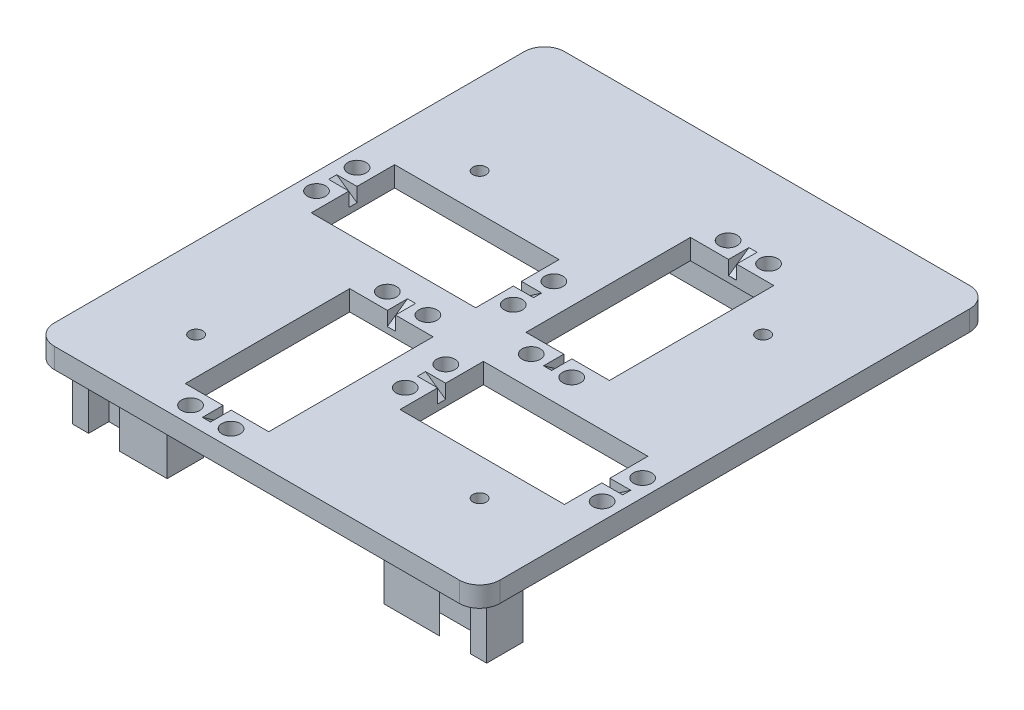
from build123d import *

# Parameters (mm, degrees)
SKETCH_1_W                 = 110
SKETCH_1_H                 = 110
EXTRUDE_1_DEPTH            = 5
SKETCH_2_R                 = 2.25
SKETCH_2_W                 = 40.6
SKETCH_2_H                 = 20.6
SKETCH_2_W_2               = 20.6
SKETCH_2_H_2               = 40.6
CUT_EXTRUDE_1_DEPTH        = 5
SKETCH_4_R                 = 1.65
CUT_EXTRUDE_2_DEPTH        = 5
CUT_EXTRUDE_3_DEPTH        = 1
PATTERN_START              = -16.519760508
PATTERN_CIRCULAR_3_DEPTH   = 1.959837541
PATTERN_START_2            = 14.653884875
PATTERN_CIRCULAR_3_2_DEPTH = 1.922796081
PATTERN_START_3            = 16.576680956
PATTERN_CIRCULAR_3_3_DEPTH = 0.077203919
PATTERN_START_4            = 14.576680956
PATTERN_CIRCULAR_3_4_DEPTH = 0.077203919
PATTERN_START_5            = -14.559922967
PATTERN_CIRCULAR_3_5_DEPTH = 0.040162459
PATTERN_START_6            = -16.559922967
PATTERN_CIRCULAR_3_6_DEPTH = 0.040162459
PATTERN_START_7            = 14.623645383
PATTERN_CIRCULAR_3_7_DEPTH = 1.96295854
PATTERN_START_8            = 16.586603923
PATTERN_CIRCULAR_3_8_DEPTH = 0.03704146
PATTERN_START_9            = 14.586603923
PATTERN_CIRCULAR_3_9_DEPTH = 0.03704146
SKETCH_9_W                 = 110
SKETCH_9_H                 = 5
EXTRUDE_4_DEPTH            = 20
EXTRUDE_5_DEPTH            = 20
EXTRUDE_6_DEPTH            = 15
CUT_EXTRUDE_4_DEPTH        = 2
FILLET_1_R                 = 2
FILLET_2_R                 = 2
FILLET_3_R                 = 2
SKETCH_13_R                = 2.5
CUT_EXTRUDE_5_DEPTH        = 1
SKETCH_14_R                = 2.5
CUT_EXTRUDE_6_DEPTH        = 1
SKETCH_15_W                = 110
SKETCH_15_H                = 5
CUT_EXTRUDE_7_DEPTH        = 4
FILLET_4_R                 = 5
SKETCH_17_W                = 2
SKETCH_17_H                = 3.5
CUT_EXTRUDE_10_DEPTH       = 4
SKETCH_18_W                = 2
SKETCH_18_H                = 3.5
CUT_EXTRUDE_11_DEPTH       = 4
SKETCH_19_W                = 2
SKETCH_19_H                = 3.5
CUT_EXTRUDE_12_DEPTH       = 4


# Read off the part's stored shape, not the designer's step: 阵列(圆周)3
with BuildPart() as part:
    # 草图1 → 凸台-拉伸1 (new body)
    with BuildSketch(Plane(origin=(0, 0, 0), x_dir=(1, 0, 0), z_dir=(0, 1, 0))):
        Rectangle(SKETCH_1_W, SKETCH_1_H)
    extrude(amount=EXTRUDE_1_DEPTH)

    # 草图2 → 切除-拉伸1 (cut)
    with BuildSketch(Plane(origin=(0, 5, 0), x_dir=(1, 0, 0), z_dir=(0, 1, 0))):
        with Locations(Location((2.2, -10.55, 0), (0, 0, 270))):
            Circle(SKETCH_2_R)
        with Locations(Location((2.2, -20.55, 0), (0, 0, 90))):
            Circle(SKETCH_2_R)
        with Locations(Location((50.8, -20.55, 0), (0, 0, 270))):
            Circle(SKETCH_2_R)
        with Locations(Location((50.8, -10.55, 0), (0, 0, 90))):
            Circle(SKETCH_2_R)
        with Locations(Location((-10.56, -50.81, 0), (0, 0, 90))):
            Circle(SKETCH_2_R)
        with Locations(Location((-20.56, -50.81, 0), (0, 0, 270))):
            Circle(SKETCH_2_R)
        with Locations(Location((-20.56, -2.21, 0), (0, 0, 90))):
            Circle(SKETCH_2_R)
        with Locations(Location((-10.56, -2.21, 0), (0, 0, 270))):
            Circle(SKETCH_2_R)
        with Locations(Location((-50.82, 10.55, 0), (0, 0, 90))):
            Circle(SKETCH_2_R)
        with Locations(Location((-50.82, 20.55, 0), (0, 0, 270))):
            Circle(SKETCH_2_R)
        with Locations(Location((-2.22, 20.55, 0), (0, 0, 90))):
            Circle(SKETCH_2_R)
        with Locations(Location((-2.22, 10.55, 0), (0, 0, 270))):
            Circle(SKETCH_2_R)
        with Locations(Location((10.54, 50.81, 0), (0, 0, 90))):
            Circle(SKETCH_2_R)
        with Locations(Location((20.54, 50.81, 0), (0, 0, 270))):
            Circle(SKETCH_2_R)
        with Locations(Location((20.54, 2.21, 0), (0, 0, 90))):
            Circle(SKETCH_2_R)
        with Locations(Location((10.54, 2.21, 0), (0, 0, 270))):
            Circle(SKETCH_2_R)
        with Locations((-26.52, 15.55)):
            Rectangle(SKETCH_2_W, SKETCH_2_H)
        with Locations((-15.56, -26.51)):
            Rectangle(SKETCH_2_W_2, SKETCH_2_H_2)
        with Locations((26.5, -15.55)):
            Rectangle(SKETCH_2_W, SKETCH_2_H)
        with Locations((15.54, 26.51)):
            Rectangle(SKETCH_2_W_2, SKETCH_2_H_2)
    extrude(amount=-CUT_EXTRUDE_1_DEPTH, mode=Mode.SUBTRACT)

    # 草图4 → 切除-拉伸2 (cut)
    with BuildSketch(Plane(origin=(0, 5, 0), x_dir=(1, 0, 0), z_dir=(0, 1, 0))):
        with Locations(Location((-35, 35, 0), (0, 0, 270))):
            Circle(SKETCH_4_R)
        with Locations(Location((35, 35, 0), (0, 0, 270))):
            Circle(SKETCH_4_R)
        with Locations(Location((35, -35, 0), (0, 0, 270))):
            Circle(SKETCH_4_R)
        with Locations(Location((-35, -35, 0), (0, 0, 270))):
            Circle(SKETCH_4_R)
    extrude(amount=-CUT_EXTRUDE_2_DEPTH, mode=Mode.SUBTRACT)

    # 草图6 → 切除-拉伸3 (cut, symmetric)
    with BuildSketch(Plane.XY.offset(-15.55)):
        Polygon((-46.82, 5), (-51.82, 5), (-46.82, 1.5), align=None)
    cut_extrude_3 = extrude(amount=CUT_EXTRUDE_3_DEPTH, both=True, mode=Mode.SUBTRACT)

    # 镜向1: 切除-拉伸3 across plane
    add(cut_extrude_3.mirror(Plane(origin=(-26.52, 0, 0), x_dir=(0, 0, 1), z_dir=(1, 0, 0))), mode=Mode.SUBTRACT)

    # 阵列(圆周)3 outline → 阵列(圆周)3 (cut)
    with BuildSketch(Plane.YZ.offset(PATTERN_START)):
        Polygon((1.5, 46.923884875), (5, 46.923884875), (5, 51.923884875), align=None)
        Polygon((1.525676669, 6.21), (5, 1.246680956), (5, 6.21), align=None)
    extrude(amount=PATTERN_CIRCULAR_3_DEPTH, mode=Mode.SUBTRACT)

    # Pattern Circular 3 2 outline → Pattern Circular 3 2 (cut)
    with BuildSketch(Plane.YZ.offset(PATTERN_START_2)):
        Polygon((5, -51.850239492), (5, -46.850239492), (1.5, -46.850239492), align=None)
        Polygon((1.500053923, -6.21), (5, -6.21), (5, -1.210077033), align=None)
    extrude(amount=PATTERN_CIRCULAR_3_2_DEPTH, mode=Mode.SUBTRACT)

    # Pattern Circular 3 3 outline → Pattern Circular 3 3 (cut)
    with BuildSketch(Plane.YZ.offset(PATTERN_START_3)):
        Polygon((5, -51.850239492), (5, -46.850239492), (1.5, -46.850239492), align=None)
    extrude(amount=PATTERN_CIRCULAR_3_3_DEPTH, mode=Mode.SUBTRACT)

    # Pattern Circular 3 4 outline → Pattern Circular 3 4 (cut)
    with BuildSketch(Plane.YZ.offset(PATTERN_START_4)):
        Polygon((1.500053923, -6.21), (5, -6.21), (5, -1.210077033), align=None)
    extrude(amount=PATTERN_CIRCULAR_3_4_DEPTH, mode=Mode.SUBTRACT)

    # Pattern Circular 3 5 outline → Pattern Circular 3 5 (cut)
    with BuildSketch(Plane.YZ.offset(PATTERN_START_5)):
        Polygon((1.5, 46.923884875), (5, 46.923884875), (5, 51.923884875), align=None)
    extrude(amount=PATTERN_CIRCULAR_3_5_DEPTH, mode=Mode.SUBTRACT)

    # Pattern Circular 3 6 outline → Pattern Circular 3 6 (cut)
    with BuildSketch(Plane.YZ.offset(PATTERN_START_6)):
        Polygon((1.525676669, 6.21), (5, 1.246680956), (5, 6.21), align=None)
    extrude(amount=PATTERN_CIRCULAR_3_6_DEPTH, mode=Mode.SUBTRACT)

    # Pattern Circular 3 7 outline → Pattern Circular 3 7 (cut)
    with BuildSketch(Plane.XY.offset(PATTERN_START_7)):
        Polygon((51.954124367, 5), (46.954124367, 5), (46.954124367, 1.5), align=None)
        Polygon((6.2, 1.525730592), (6.2, 5), (1.236757989, 5), align=None)
    extrude(amount=PATTERN_CIRCULAR_3_7_DEPTH, mode=Mode.SUBTRACT)

    # Pattern Circular 3 8 outline → Pattern Circular 3 8 (cut)
    with BuildSketch(Plane.XY.offset(PATTERN_START_8)):
        Polygon((51.954124367, 5), (46.954124367, 5), (46.954124367, 1.5), align=None)
    extrude(amount=PATTERN_CIRCULAR_3_8_DEPTH, mode=Mode.SUBTRACT)

    # Pattern Circular 3 9 outline → Pattern Circular 3 9 (cut)
    with BuildSketch(Plane.XY.offset(PATTERN_START_9)):
        Polygon((6.2, 1.525730592), (6.2, 5), (1.236757989, 5), align=None)
    extrude(amount=PATTERN_CIRCULAR_3_9_DEPTH, mode=Mode.SUBTRACT)

    # 草图9 → 凸台-拉伸4 (add)
    with BuildSketch(Plane(origin=(0, 0, -55), x_dir=(-1, 0, 0), z_dir=(0, 0, -1))):
        with Locations((0, 2.5)):
            Rectangle(SKETCH_9_W, SKETCH_9_H)
    extrude(amount=EXTRUDE_4_DEPTH)

    # 草图10 → 凸台-拉伸5 (add)
    with BuildSketch(Plane(origin=(0, 5, 0), x_dir=(1, 0, 0), z_dir=(0, 1, 0))):
        Polygon((26.679814029, 60.6), (12.667174987, 65.571224494), (31.679814029, 65.571224494), (31.679814029, 56.6), (-31.679814029, 56.6), (-31.679814029, 65.571224494), (-12.667174987, 65.571224494), (-26.679814029, 60.6), align=None)
    extrude(amount=-EXTRUDE_5_DEPTH)

    # 草图11 → 凸台-拉伸6 (add)
    with BuildSketch(Plane.XZ):
        Polygon((47.14, 44.39), (47.14, 49.39), (51.14, 49.39), (51.14, 40.39), (25.757217781, 40.39), (25.757217781, 49.39), (39.507217781, 49.39), (30.757217781, 44.39), align=None)
    extrude_6 = extrude(amount=EXTRUDE_6_DEPTH)

    # 镜向2: 凸台-拉伸6 across plane
    add(extrude_6.mirror(Plane(origin=(0, 0, 0), x_dir=(0, 0, 1), z_dir=(1, 0, 0))))

    # 草图12 → 切除-拉伸4 (cut)
    with BuildSketch(Plane(origin=(-25.757217781, 0, 0), x_dir=(0, 0, -1), z_dir=(1, 0, 0))):
        Polygon((-46.81, 0), (-49.39, 0), (-49.39, -15), (-40.39, -15), (-40.39, 0), align=None)
    extrude(amount=-CUT_EXTRUDE_4_DEPTH, mode=Mode.SUBTRACT)

    # 圆角1
    fillet_1_edges = [part.edges().sort_by_distance(p)[0] for p in [
        (-51.14, 0, 44.89),
        (-49.14, 0, 49.39),
        (-33.632217781, 0, 49.39),
        (-39.448608891, 0, 40.39),
    ]]
    fillet(fillet_1_edges, radius=FILLET_1_R)

    # 圆角2
    fillet_2_edges = [part.edges().sort_by_distance(p)[0] for p in [
        (32.632217781, 0, 49.39),
        (25.757217781, 0, 44.89),
        (38.448608891, 0, 40.39),
        (51.14, 0, 44.89),
        (49.14, 0, 49.39),
    ]]
    fillet(fillet_2_edges, radius=FILLET_2_R)

    # 圆角3
    fillet_3_edges = [part.edges().sort_by_distance(p)[0] for p in [
        (-22.173494508, 0, -65.571224494),
        (-31.679814029, 0, -61.085612247),
        (0, 0, -56.6),
        (31.679814029, 0, -61.085612247),
        (22.173494508, 0, -65.571224494),
    ]]
    fillet(fillet_3_edges, radius=FILLET_3_R)

    # 草图13 → 切除-拉伸5 (cut)
    with BuildSketch(Plane(origin=(0, 0, -60.6), x_dir=(-1, 0, 0), z_dir=(0, 0, -1))):
        with Locations((0, -8)):
            Circle(SKETCH_13_R)
    extrude(amount=-CUT_EXTRUDE_5_DEPTH, mode=Mode.SUBTRACT)

    # 草图14 → 切除-拉伸6 (cut)
    with BuildSketch(Plane.XY.offset(44.39)):
        with Locations((43.66, -8)):
            Circle(SKETCH_14_R)
    cut_extrude_6 = extrude(amount=-CUT_EXTRUDE_6_DEPTH, mode=Mode.SUBTRACT)

    # 镜向4: 切除-拉伸6 across plane
    add(cut_extrude_6.mirror(Plane(origin=(0, 0, 0), x_dir=(0, 0, 1), z_dir=(1, 0, 0))), mode=Mode.SUBTRACT)

    # 草图15 → 切除-拉伸7 (cut)
    with BuildSketch(Plane(origin=(0, 0, -75), x_dir=(-1, 0, 0), z_dir=(0, 0, -1))):
        with Locations((0, 2.5)):
            Rectangle(SKETCH_15_W, SKETCH_15_H)
    extrude(amount=-CUT_EXTRUDE_7_DEPTH, mode=Mode.SUBTRACT)

    # 圆角4
    fillet_4_edges = [part.edges().sort_by_distance(p)[0] for p in [
        (-55, 2.5, -71),
        (55, 2.5, -71),
        (55, 2.5, 55),
        (-55, 2.5, 55),
    ]]
    fillet(fillet_4_edges, radius=FILLET_4_R)

    # 草图17 → 切除-拉伸10 (cut)
    with BuildSketch(Plane(origin=(0, 0, -46.850239492), x_dir=(-1, 0, 0), z_dir=(0, 0, -1))):
        with Locations((-15.653884875, 3.25)):
            Rectangle(SKETCH_17_W, SKETCH_17_H)
    extrude(amount=-CUT_EXTRUDE_10_DEPTH, mode=Mode.SUBTRACT)

    # 草图18 → 切除-拉伸11 (cut)
    with BuildSketch(Plane.XY.offset(46.923884875)):
        with Locations((-15.519760508, 3.25)):
            Rectangle(SKETCH_18_W, SKETCH_18_H)
    extrude(amount=-CUT_EXTRUDE_11_DEPTH, mode=Mode.SUBTRACT)

    # 草图19 → 切除-拉伸12 (cut)
    with BuildSketch(Plane(origin=(46.954124367, 0, 0), x_dir=(0, 0, -1), z_dir=(1, 0, 0))):
        with Locations((-15.623645383, 3.25)):
            Rectangle(SKETCH_19_W, SKETCH_19_H)
    extrude(amount=-CUT_EXTRUDE_12_DEPTH, mode=Mode.SUBTRACT)


solid = part.part
